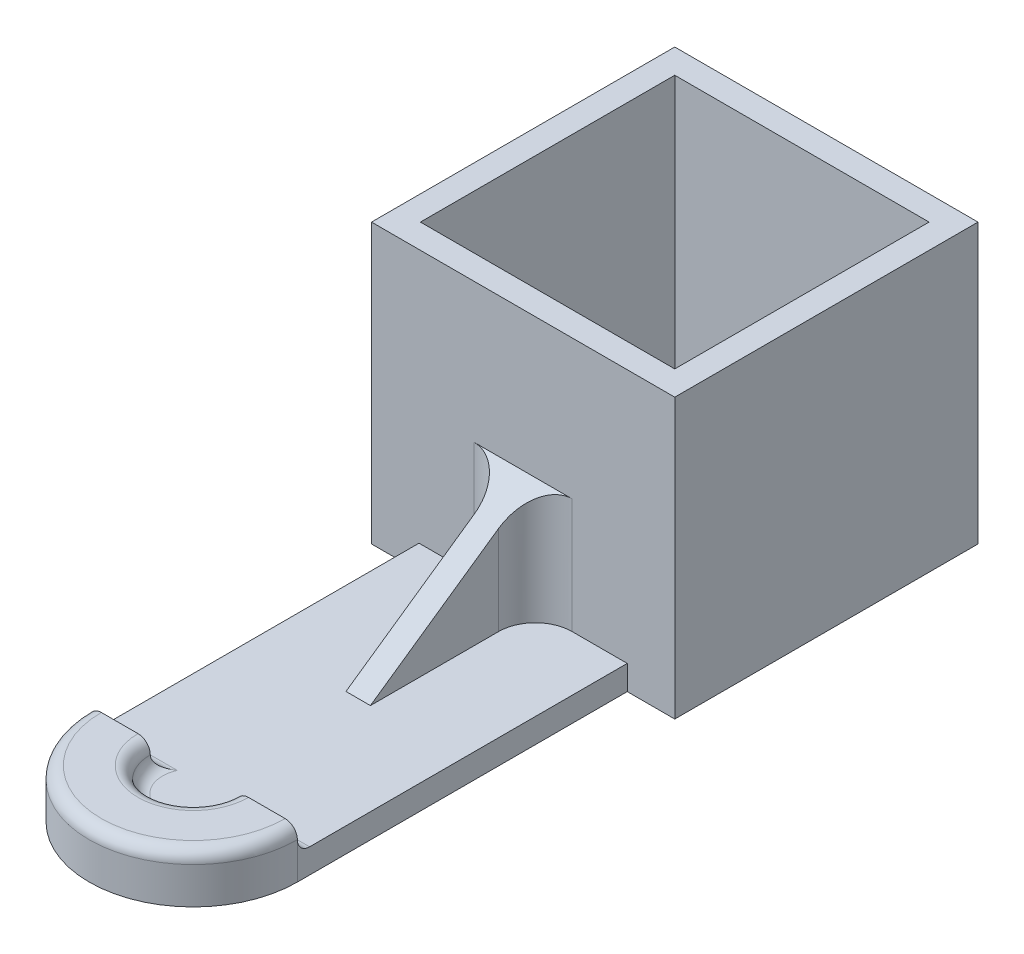
from build123d import *

# Parameters (mm, degrees)
SKETCH1_W           = 24.80083823
SKETCH1_H           = 24.80083823
SKETCH1_W_2         = 20.80083823
SKETCH1_H_2         = 20.80083823
EXTRUDE_THIN1_DEPTH = 20.80083823
SKETCH2_W           = 24.80083823
SKETCH2_H           = 24.80083823
BOSS_EXTRUDE1_DEPTH = 2
BOSS_EXTRUDE2_DEPTH = 2
BOSS_EXTRUDE3_DEPTH = 1
FILLET2_R           = 3
EXTRUDE_THIN2_DEPTH = 2
FILLET3_R           = 1


with BuildPart() as part:
    # Sketch1 → Extrude-Thin1 (new body)
    with BuildSketch(Plane(origin=(0, 0, 0), x_dir=(1, 0, 0), z_dir=(0, 1, 0))):
        with Locations((10.400419115, 10.400419115)):
            Rectangle(SKETCH1_W, SKETCH1_H)
        with Locations((10.400419115, 10.400419115)):
            Rectangle(SKETCH1_W_2, SKETCH1_H_2, mode=Mode.SUBTRACT)
    extrude(amount=EXTRUDE_THIN1_DEPTH)

    # Sketch2 → Boss-Extrude1 (add)
    with BuildSketch(Plane.XZ):
        with Locations((10.400419115, -10.400419115)):
            Rectangle(SKETCH2_W, SKETCH2_H)
    extrude(amount=BOSS_EXTRUDE1_DEPTH)

    # Sketch4 → Boss-Extrude2 (add)
    with BuildSketch(Plane.XZ.offset(2)):
        with BuildLine():
            Line((1.884963608, 2), (1.884963608, 28.980417336))
            ThreePointArc((1.884963608, 28.980417336), (10.400419115, 37.495872843), (18.915874622, 28.980417336))
            Line((18.915874622, 28.980417336), (18.915874622, 2))
            ThreePointArc((18.915874622, 2), (10.400419115, -6.515455507), (1.884963608, 2))
        make_face()
    extrude(amount=-BOSS_EXTRUDE2_DEPTH)

    # Sketch5 → Boss-Extrude3 (add, symmetric)
    with BuildSketch(Plane(origin=(10.400419115, 0, 0), x_dir=(0, 0, -1), z_dir=(1, 0, 0))):
        Polygon((-2, 9.400419115), (-15.490208668, 0), (-2, 0), align=None)
    extrude(amount=BOSS_EXTRUDE3_DEPTH, both=True)

    # Fillet2
    fillet2_edges = [part.edges().sort_by_distance(p)[0] for p in [
        (9.400419115, 4.700209558, 2),
        (11.400419115, 4.700209558, 2),
    ]]
    fillet(fillet2_edges, radius=FILLET2_R)

    # Sketch6 → Extrude-Thin2 (add)
    with BuildSketch(Plane(origin=(0, 0, 0), x_dir=(1, 0, 0), z_dir=(0, 1, 0))):
        with BuildLine():
            ThreePointArc((1.884963608, -28.980417336), (10.400419115, -37.495872843), (18.915874622, -28.980417336))
            Line((18.915874622, -28.980417336), (13.915874622, -28.980417336))
            ThreePointArc((13.915874622, -28.980417336), (10.400419115, -32.495872843), (6.884963608, -28.980417336))
            Line((6.884963608, -28.980417336), (1.884963608, -28.980417336))
        make_face()
    extrude(amount=EXTRUDE_THIN2_DEPTH)

    # Fillet3
    fillet3_edges = [part.edges().sort_by_distance(p)[0] for p in [
        (16.415874622, 0, 28.980417336),
        (4.384963608, 0, 28.980417336),
        (10.400419115, 2, 37.495872843),
        (10.400419115, 2, 32.495872843),
        (10.400419115, 0, 32.495872843),
    ]]
    fillet(fillet3_edges, radius=FILLET3_R - 0.0001)  # a hair under: the kernel refuses the full size


solid = part.part
